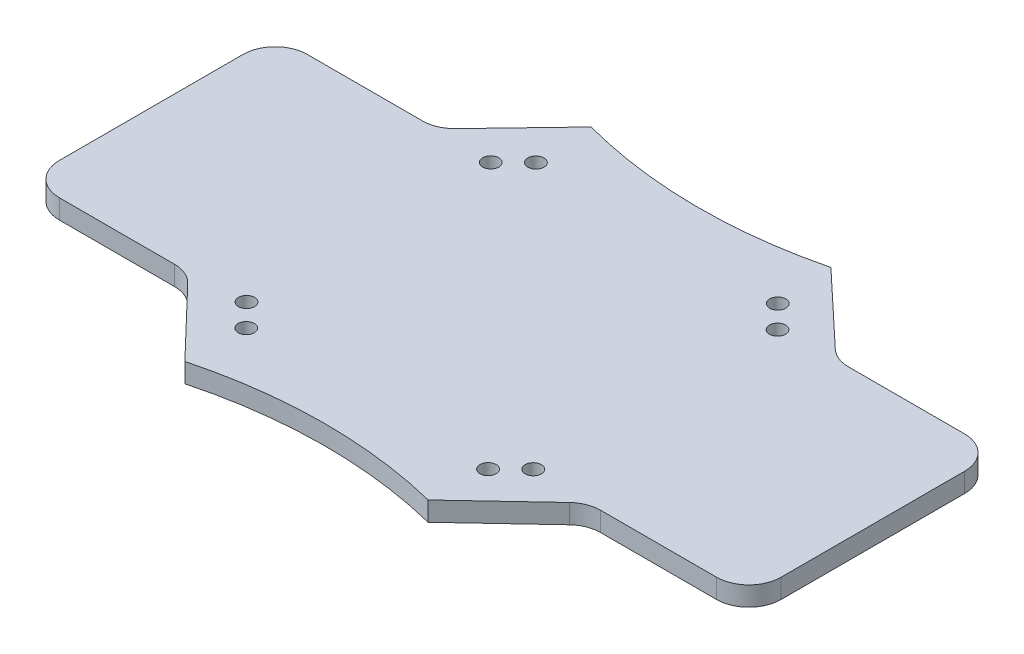
from build123d import *

# Parameters (mm, degrees)
EXTRUDE_1_DEPTH          = 3
SKETCH_2_R               = 2.5
CUT_EXTRUDE_2_DEPTH      = 129.655162729
PATTERN_CIRCULAR_1_COUNT = 4


with BuildPart() as part:
    # 草图1 → 凸台-拉伸1 (new, symmetric)
    with BuildSketch(Plane(origin=(0, 0, 0), x_dir=(1, 0, 0), z_dir=(0, 1, 0))):
        with BuildLine():
            Line((-112, -28.5), (-112, 28.5))
            ThreePointArc((-112, 28.5), (-109.071067812, 35.571067812), (-102, 38.5))
            Line((-102, 38.5), (-66.267701316, 38.5))
            ThreePointArc((-66.267701316, 38.5), (-62.342509424, 39.302561845), (-59.047359382, 41.581426278))
            Line((-59.047359382, 41.581426278), (-38.5, 63.025002156))
            ThreePointArc((-38.5, 63.025002156), (-1.05045845, 58.003678255), (36.465737343, 62.5))
            Line((36.465737343, 62.5), (59.113129209, 41.213409035))
            ThreePointArc((59.113129209, 41.213409035), (62.278547938, 39.203067451), (65.961894945, 38.5))
            Line((65.961894945, 38.5), (102, 38.5))
            ThreePointArc((102, 38.5), (109.071067812, 35.571067812), (112, 28.5))
            Line((112, 28.5), (112, -28.5))
            ThreePointArc((112, -28.5), (109.071067812, -35.571067812), (102, -38.5))
            Line((102, -38.5), (65.961894945, -38.5))
            ThreePointArc((65.961894945, -38.5), (62.278547938, -39.203067451), (59.113129209, -41.213409035))
            Line((59.113129209, -41.213409035), (36.465737343, -62.5))
            ThreePointArc((36.465737343, -62.5), (-1.05045845, -58.003678255), (-38.5, -63.025002156))
            Line((-38.5, -63.025002156), (-59.047359382, -41.581426278))
            ThreePointArc((-59.047359382, -41.581426278), (-62.342509424, -39.302561845), (-66.267701316, -38.5))
            Line((-66.267701316, -38.5), (-102, -38.5))
            ThreePointArc((-102, -38.5), (-109.071067812, -35.571067812), (-112, -28.5))
        make_face()
    extrude(amount=EXTRUDE_1_DEPTH, both=True)

    # 草图2 → 切除-拉伸2 (cut, through all)
    with BuildSketch(Plane(origin=(0, 3, 0), x_dir=(1, 0, 0), z_dir=(0, 1, 0))):
        with Locations((37.940328281, 44.532471851)):
            Circle(SKETCH_2_R)
        with Locations((44.914250133, 37.487593872)):
            Circle(SKETCH_2_R)
    cut_extrude_2 = extrude(amount=-CUT_EXTRUDE_2_DEPTH, mode=Mode.SUBTRACT)

    # 阵列(圆周)1: 切除-拉伸2 ×4 about axis
    pattern_circular_1_axis = Axis((0, -142.040328777, 0), (0, 1, 0))
    for i in range(1, PATTERN_CIRCULAR_1_COUNT):
        add(cut_extrude_2.rotate(pattern_circular_1_axis, i * 360 / PATTERN_CIRCULAR_1_COUNT), mode=Mode.SUBTRACT)


solid = part.part
